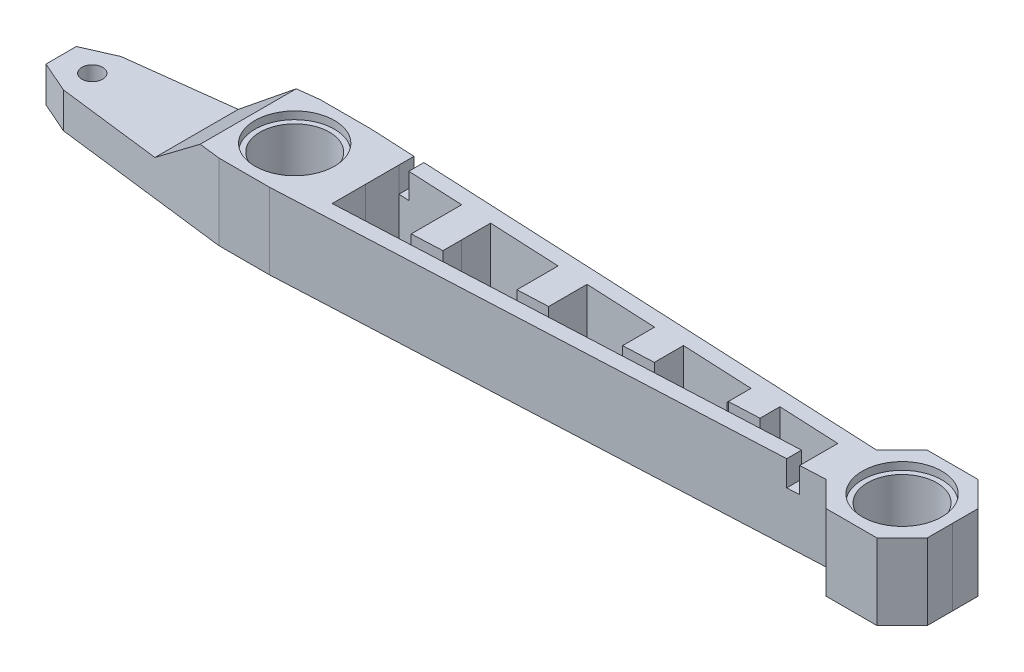
from build123d import *
from OCP.BRepAlgoAPI import BRepAlgoAPI_Cut
from OCP.TopTools import TopTools_ListOfShape
from build123d.topology import SkipClean

# Parameters (mm, degrees)
SKETCH1_R           = 2.05
SKETCH1_R_2         = 6.85
BOSS_EXTRUDE1_DEPTH = 15
SKETCH1_3_R         = 7.85
CUT_EXTRUDE1_DEPTH  = 1.5
CUT_EXTRUDE2_START  = 13.5
SKETCH1_4_R         = 7.85
CUT_EXTRUDE2_DEPTH  = 1.5
CUT_EXTRUDE18_DEPTH = 15
CUT_EXTRUDE19_DEPTH = 15
CUT_EXTRUDE20_DEPTH = 5
CUT_EXTRUDE21_DEPTH = 25
BOSS_EXTRUDE2_START = 8
SKETCH9_R           = 2.05
BOSS_EXTRUDE2_DEPTH = 8
CUT_EXTRUDE22_DEPTH = 30


with BuildPart() as part:
    # Sketch1 → Boss-Extrude1 (new body)
    with BuildSketch(Plane(origin=(0, 0, 0), x_dir=(1, 0, 0), z_dir=(0, 1, 0))):
        Polygon((91.286914415, -0.000755057), (91.286914415, -5.000755057), (86.287669472, -10), (76.287669472, -10), (71.288424529, -5.000755057), (-33.712330528, -10), (-43.712330528, -10), (-78.712330528, -5.702540368), (-84.854022115, -3), (-84.854022115, 0), (-84.853996395, 3), (-78.712281638, 5.702487713), (-43.712244796, 9.999647278), (-33.712244796, 9.999561545), (71.288467397, 4.999416396), (76.2877552, 9.998618479), (86.287755199, 9.998532746), (91.286957282, 4.999244943), align=None)
        with Locations(Location((-78.712330528, 0, 0), (0, 0, 270))):
            Circle(SKETCH1_R, mode=Mode.SUBTRACT)
        with Locations(Location((81.287669472, 0, 0), (0, 0, 270))):
            Circle(SKETCH1_R_2, mode=Mode.SUBTRACT)
        with Locations(Location((-38.712330528, 0, 0), (0, 0, 270))):
            Circle(SKETCH1_R_2, mode=Mode.SUBTRACT)
    extrude(amount=BOSS_EXTRUDE1_DEPTH)

    # Sketch1<3> → Cut-Extrude1 (cut)
    with BuildSketch(Plane(origin=(0, 0, 0), x_dir=(1, 0, 0), z_dir=(0, 1, 0))):
        with Locations(Location((-38.712330528, 0, 0), (0, 0, 270))):
            Circle(SKETCH1_3_R)
        with Locations(Location((81.287669472, 0, 0), (0, 0, 270))):
            Circle(SKETCH1_3_R)
    extrude(amount=CUT_EXTRUDE1_DEPTH, mode=Mode.SUBTRACT)

    # Sketch1<4> → Cut-Extrude2 (cut)
    with BuildSketch(Plane(origin=(0, 0, 0), x_dir=(1, 0, 0), z_dir=(0, 1, 0)).offset(CUT_EXTRUDE2_START)):
        with Locations(Location((-38.712330528, 0, 0), (0, 0, 270))):
            Circle(SKETCH1_4_R)
        with Locations(Location((81.287669472, 0, 0), (0, 0, 270))):
            Circle(SKETCH1_4_R)
    extrude(amount=CUT_EXTRUDE2_DEPTH, mode=Mode.SUBTRACT)

    # Sketch2 → Cut-Extrude18 (cut)
    with BuildSketch(Plane(origin=(0, 15, 0), x_dir=(1, 0, 0), z_dir=(0, 1, 0))):
        Polygon((-24.712374044, 6.599650564), (-11.712369995, 5.985582494), (-11.712330529, -0.000306581), (-11.712330529, -5.986195656), (-24.712330529, -6.600349436), (-24.712330529, -0.000349436), align=None)
        Polygon((-5.712330529, -0.000286801), (-5.712368126, 5.702166462), (8.287636234, 5.040862387), (8.287669471, -0.000240649), (8.287669471, -5.041343686), (-5.712330529, -5.702740065), align=None)
    extrude(amount=-CUT_EXTRUDE18_DEPTH, mode=Mode.SUBTRACT)

    # Sketch5 → Cut-Extrude19 (cut)
    with BuildSketch(Plane(origin=(0, 15, 0), x_dir=(1, 0, 0), z_dir=(0, 1, 0))):
        Polygon((14.287669471, -4.757888095), (14.287638103, 4.757446355), (28.287642463, 4.09614228), (28.287669471, -4.096491716), align=None)
        Polygon((34.287644332, 3.812726248), (48.287648692, 3.151422173), (48.287669471, -3.151639747), (34.287669471, -3.813036126), align=None)
        Polygon((54.287650561, 2.868006141), (66.2876543, 2.301174077), (66.287669472, -2.301272974), (54.287669471, -2.868184156), align=None)
    extrude(amount=-CUT_EXTRUDE19_DEPTH, mode=Mode.SUBTRACT)


with BuildPart() as cut_extrude20_tool:
    # Sketch6 → Cut-Extrude20 (new body)
    with BuildSketch(Plane(origin=(0, 15, 0), x_dir=(1, 0, 0), z_dir=(0, 1, 0))):
        Polygon((-24.712374044, 9.570986737), (-22.664694465, 9.473476016), (-22.664694465, 6.50292639), (-24.712374044, 6.599650564), align=None)
        Polygon((64.239989057, -2.398010718), (66.287669472, -2.301272974), (66.287669472, -5.238848578), (64.239989057, -5.336341743), (63.843088459, -5.355238781), (63.843088459, -2.416761333), align=None)
        Polygon((54.287669471, -1.068184156), (54.287669471, -2.868184156), (48.287669471, -3.151639747), (48.287669471, -1.575940198), (48.294422194, -1.333159375), align=None)
        Polygon((34.287669471, -1.952430065), (28.287669471, -2.217703838), (28.287669471, -4.096491716), (34.287669471, -3.813036126), align=None)
        Polygon((8.287669471, -3.101949747), (14.287669471, -2.836675974), (14.287669471, -4.757888095), (8.287669471, -5.041343686), align=None)
        Polygon((-5.712330529, -3.720921883), (-11.712330529, -3.986195656), (-11.712330529, -5.986195656), (-5.712330529, -5.702740065), align=None)
    extrude(amount=-CUT_EXTRUDE20_DEPTH)


with BuildPart() as part_1:
    add(part.part)

    # Cut-Extrude20: cut by cut_extrude20_tool, with a tolerance
    cut_extrude20_stock = TopTools_ListOfShape()
    cut_extrude20_stock.Append(part_1.part.wrapped)
    cut_extrude20_tools = TopTools_ListOfShape()
    cut_extrude20_tools.Append(cut_extrude20_tool.part.wrapped)
    cut_extrude20_cut = BRepAlgoAPI_Cut()
    cut_extrude20_cut.SetArguments(cut_extrude20_stock)
    cut_extrude20_cut.SetTools(cut_extrude20_tools)
    cut_extrude20_cut.SetFuzzyValue(0.00001)
    cut_extrude20_cut.Build()
    add(Compound.cast(cut_extrude20_cut.Shape()).solids(), mode=Mode.REPLACE)

    # Sketch8 → Cut-Extrude21 (cut)
    with BuildSketch(Plane.XY.offset(10)):
        Polygon((-47.904022115, 0), (-58.104022115, 8), (-84.854022115, 8), (-84.854022115, 0), align=None)
    extrude(amount=-CUT_EXTRUDE21_DEPTH, mode=Mode.SUBTRACT)

    # Sketch9 → Boss-Extrude2 (add)
    with SkipClean():  # the faces are left unmerged after this step: merging them gives an invalid solid
        with BuildSketch(Plane.XZ.offset(-8).offset(BOSS_EXTRUDE2_START)):
            Polygon((-84.854022115, 3), (-84.853996395, -3), (-78.712281638, -5.702487713), (-47.032796515, -9.591963691), (-47.380824321, 9.5495656), (-78.712330528, 5.702540368), align=None)
            with Locations((-78.712330528, 0)):
                Circle(SKETCH9_R, mode=Mode.SUBTRACT)
        extrude(amount=-BOSS_EXTRUDE2_DEPTH)

    # Sketch10 → Cut-Extrude22 (cut)
    with BuildSketch(Plane(origin=(8.5727e-05, 0, -9.999272518), x_dir=(-0.9999999999632491, 0, -8.573327994754198e-06), z_dir=(8.573327994754198e-06, 0, -0.9999999999632491))):
        Polygon((47.904022112, 15), (58.104022112, 7), (84.854022112, 7), (84.854022112, 15), align=None)
    extrude(amount=-CUT_EXTRUDE22_DEPTH, mode=Mode.SUBTRACT)


solid = part_1.part
